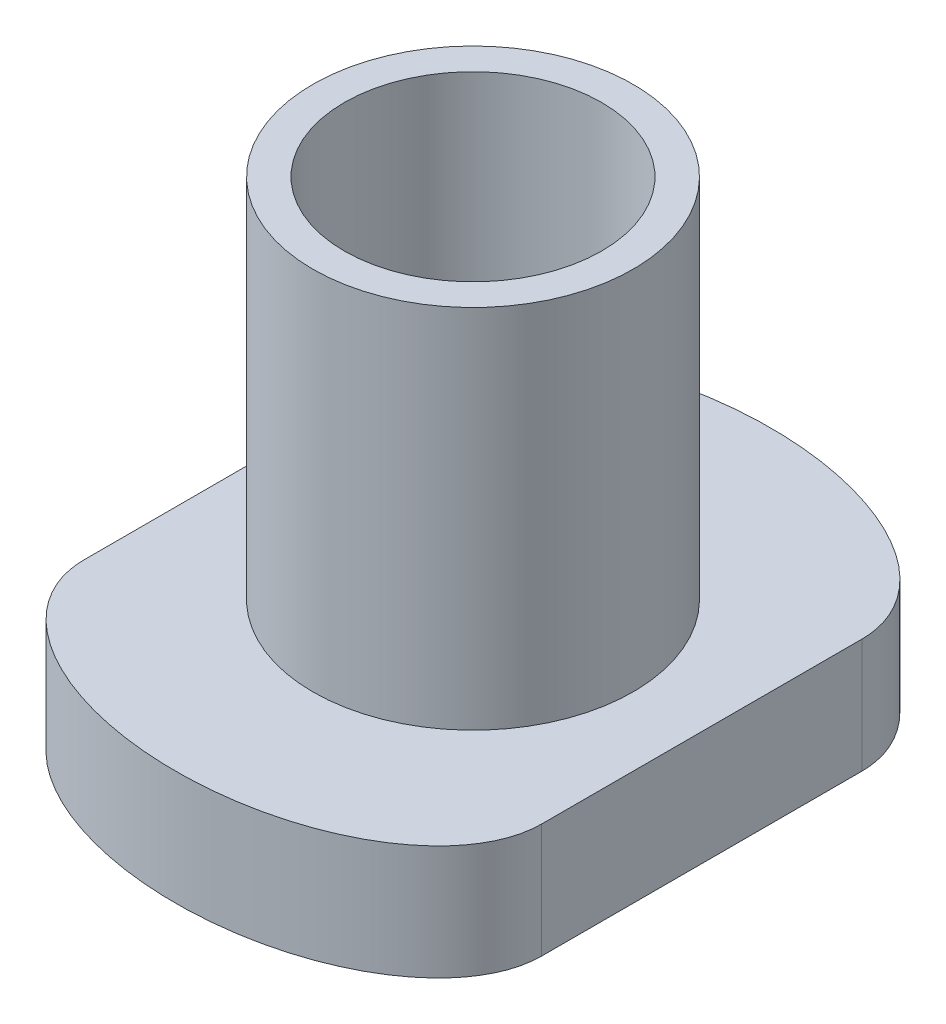
from build123d import *

# Parameters (mm, degrees)
BOSS_EXTRUDE1_DEPTH = 10
SKETCH2_R           = 14
BOSS_EXTRUDE2_DEPTH = 32
SKETCH3_R           = 11.25
CUT_EXTRUDE1_DEPTH  = 78.897368549


with BuildPart() as part:
    # Sketch1 → Boss-Extrude1 (new body)
    with BuildSketch(Plane(origin=(0, 0, 0), x_dir=(1, 0, 0), z_dir=(0, 1, 0))):
        with BuildLine():
            Line((0, 40), (0, 12))
            add(Edge.make_bspline(
                [(0, 12), (0, 0), (20, 0), (40, 0), (40, 12)],
                knots=[3.141592654, 3.141592654, 3.141592654, 4.71238898, 4.71238898, 6.283185307, 6.283185307, 6.283185307], degree=2, weights=[1, 0.707106781, 1, 0.707106781, 1]))
            Line((40, 12), (40, 40))
            add(Edge.make_bspline(
                [(40, 40), (40, 52), (20, 52), (0, 52), (0, 40)],
                knots=[3.141592654, 3.141592654, 3.141592654, 4.71238898, 4.71238898, 6.283185307, 6.283185307, 6.283185307], degree=2, weights=[1, 0.707106781, 1, 0.707106781, 1]))
        make_face()
    extrude(amount=BOSS_EXTRUDE1_DEPTH)

    # Sketch2 → Boss-Extrude2 (add)
    with BuildSketch(Plane(origin=(0, 10, 0), x_dir=(1, 0, 0), z_dir=(0, 1, 0))):
        with Locations((20, 26)):
            Circle(SKETCH2_R)
    extrude(amount=BOSS_EXTRUDE2_DEPTH)

    # Sketch3 → Cut-Extrude1 (cut, through all)
    with BuildSketch(Plane(origin=(0, 42, 0), x_dir=(1, 0, 0), z_dir=(0, 1, 0))):
        with Locations((20, 26)):
            Circle(SKETCH3_R)
    extrude(amount=-CUT_EXTRUDE1_DEPTH, mode=Mode.SUBTRACT)


solid = part.part
